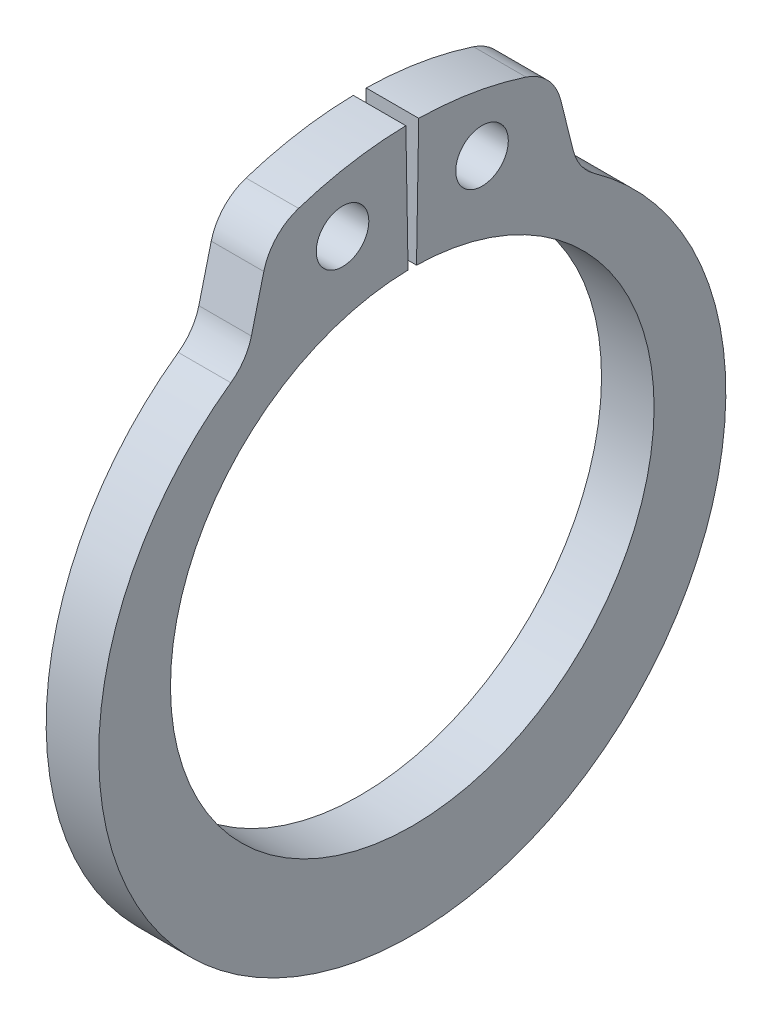
from build123d import *

# Parameters (mm, degrees)
SKETCH1_R      = 0.635
EXTRUDE1_DEPTH = 0.635
FILLET1_R      = 1.27


with BuildPart() as part:
    # Sketch1 → Extrude1 (new, symmetric)
    with BuildSketch(Plane(origin=(0, 0, 0), x_dir=(0, 0, -1), z_dir=(1, 0, 0))):
        with BuildLine():
            Line((-0.101956958, 5.841110235), (-0.155151893, 8.88864601))
            ThreePointArc((-0.155151893, 8.88864601), (-1.822675913, 8.701146621), (-3.425260789, 8.203638737))
            Line((-3.425260789, 8.203638737), (-4.005394532, 5.876849381))
            ThreePointArc((-4.005394532, 5.876849381), (0, -8.128), (4.005394532, 5.876849381))
            Line((4.005394532, 5.876849381), (3.425260789, 8.203638737))
            ThreePointArc((3.425260789, 8.203638737), (1.822675913, 8.701146621), (0.155151893, 8.88864601))
            Line((0.155151893, 8.88864601), (0.101956958, 5.841110235))
            ThreePointArc((0.101956958, 5.841110235), (0, -5.842), (-0.101956958, 5.841110235))
        make_face()
        with Locations((-1.684986776, 7.337710495)):
            Circle(SKETCH1_R, mode=Mode.SUBTRACT)
        with Locations((1.684986776, 7.337710495)):
            Circle(SKETCH1_R, mode=Mode.SUBTRACT)
    extrude(amount=EXTRUDE1_DEPTH, both=True)

    # Fillet1
    fillet1_edges = [part.edges().sort_by_distance(p)[0] for p in [
        (0, 5.876849381, 4.005394532),
        (0, 8.203638737, 3.425260789),
        (0, 8.203638737, -3.425260789),
        (0, 5.876849381, -4.005394532),
    ]]
    fillet(fillet1_edges, radius=FILLET1_R)


solid = part.part
